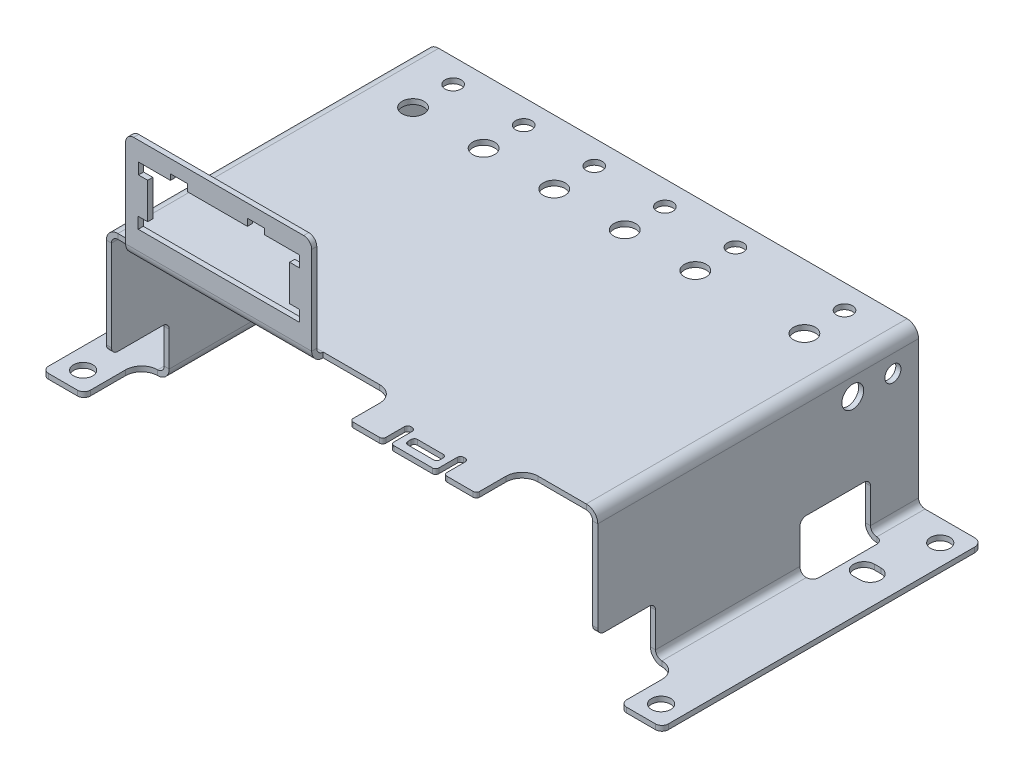
from build123d import *

# Parameters (mm, degrees)
SKETCH1_W                      = 150
SKETCH1_H                      = 100
BASE_FLANGE1_DEPTH             = 1.5875
EDGE_FLANGE1_STRIP_W           = 20.35
EDGE_FLANGE1_STRIP_H           = 1.5875
EDGE_FLANGE1_STRIP_CUT_DEPTH   = 100
EDGE_FLANGE1_STRIP_2_W         = 20.35
EDGE_FLANGE1_STRIP_2_H         = 1.5875
EDGE_FLANGE1_STRIP_CUT_2_DEPTH = 100
EDGE_FLANGE1_DEPTH             = 100
EDGE_FLANGE1_BEND_DEPTH        = 100
EDGE_FLANGE2_STRIP_W           = 20.35
EDGE_FLANGE2_STRIP_H           = 1.5875
EDGE_FLANGE2_STRIP_CUT_DEPTH   = 100
EDGE_FLANGE2_STRIP_2_W         = 20.35
EDGE_FLANGE2_STRIP_2_H         = 1.5875
EDGE_FLANGE2_STRIP_CUT_2_DEPTH = 100
EDGE_FLANGE2_DEPTH             = 100
EDGE_FLANGE2_BEND_DEPTH        = 100
CUT_EXTRUDE1_START             = -50.175
CUT_EXTRUDE1_OUTLINE_W         = 167.175
CUT_EXTRUDE1_OUTLINE_H         = 18
CUT_EXTRUDE1_DEPTH             = 3.5875
FILLET1_R                      = 5
CUT_EXTRUDE2_DEPTH             = 188.101873988
CUT_EXTRUDE2_DEPTH_BACK        = 188.101873988
SKETCH19_W                     = 18
SKETCH19_H                     = 14.75
FILLET2_R                      = 2
CUT_EXTRUDE4_DEPTH             = 120.777609682
CUT_EXTRUDE5_START             = -50.175
CUT_EXTRUDE5_OUTLINE_W         = 3.5875
CUT_EXTRUDE5_OUTLINE_H         = 22
CUT_EXTRUDE5_DEPTH             = 16.3375
FILLET3_R                      = 2
FILLET4_R                      = 2.5
SKETCH22_W                     = 10
SKETCH22_H                     = 3
TAB1_DEPTH                     = 1.5875
FILLET5_R                      = 1
EDGE_FLANGE3_DEPTH             = 58
FILLET6_R                      = 2.5
CUT_EXTRUDE6_DEPTH             = 10
FILLET7_R                      = 5
SKETCH31_R                     = 3
CUT_EXTRUDE10_DEPTH            = 127.39121125
SKETCH33_R                     = 2.5
SKETCH33_R_2                   = 3.4
CUT_EXTRUDE11_DEPTH            = 10
SKETCH35_W                     = 2
SKETCH35_H                     = 22
CUT_EXTRUDE13_DEPTH            = 142.249965708
FILLET8_R                      = 2
CUT_EXTRUDE15_DEPTH            = 127.39121125
CUT_EXTRUDE15_DEPTH_BACK       = 127.39121125
SKETCH43_R                     = 2.5
SKETCH43_R_2                   = 3.4


# Read off the part's stored shape, not the designer's step: Cut-Extrude1, Cut-Extrude5
# Sheet-metal steps are written as plain solids
with BuildPart() as part:
    # Sketch1 → Base-Flange1 (new body)
    with BuildSketch(Plane(origin=(0, 0, 0), x_dir=(1, 0, 0), z_dir=(0, 1, 0))):
        Rectangle(SKETCH1_W, SKETCH1_H)
    extrude(amount=-BASE_FLANGE1_DEPTH)

    # Edge-Flange1 strip (across the edge) → Edge-Flange1 strip cut (cut)
    with BuildSketch(Plane(origin=(-75, -1.5875, 50), x_dir=(1, 0, 0), z_dir=(0, 0, -1))):
        with Locations((-8.175, -0.79375)):
            Rectangle(EDGE_FLANGE1_STRIP_W, EDGE_FLANGE1_STRIP_H)
    extrude(amount=EDGE_FLANGE1_STRIP_CUT_DEPTH, mode=Mode.SUBTRACT)

    # Edge-Flange1 strip 2 (across the edge) → Edge-Flange1 strip cut 2 (cut)
    with BuildSketch(Plane(origin=(75, -1.5875, -50), x_dir=(-1, 0, 0), z_dir=(0, 0, 1))):
        with Locations((-8.175, -0.79375)):
            Rectangle(EDGE_FLANGE1_STRIP_2_W, EDGE_FLANGE1_STRIP_2_H)
    extrude(amount=EDGE_FLANGE1_STRIP_CUT_2_DEPTH, mode=Mode.SUBTRACT)

    # Edge-Flange1 section (across the edge) → Edge-Flange1 (add)
    with BuildSketch(Plane(origin=(-75, -1.5875, 50), x_dir=(1, 0, 0), z_dir=(0, 0, -1))):
        with BuildLine():
            Line((-1.5875, 2), (-1.5875, 47))
            Line((-1.5875, 47), (0, 47))
            Line((0, 47), (0, 2))
            ThreePointArc((0, 2), (0.585786438, 0.585786438), (2, 0))
            Line((2, 0), (2, -1.5875))
            ThreePointArc((2, -1.5875), (-0.536745578, -0.536745578), (-1.5875, 2))
        make_face()
    extrude(amount=EDGE_FLANGE1_DEPTH)

    # Edge-Flange1 section 2 (across the edge) → Edge-Flange1 bend (add)
    with BuildSketch(Plane(origin=(75, -1.5875, -50), x_dir=(-1, 0, 0), z_dir=(0, 0, 1))):
        with BuildLine():
            Line((-1.5875, 2), (-1.5875, 47))
            Line((-1.5875, 47), (0, 47))
            Line((0, 47), (0, 2))
            ThreePointArc((0, 2), (0.585786438, 0.585786438), (2, 0))
            Line((2, 0), (2, -1.5875))
            ThreePointArc((2, -1.5875), (-0.536745578, -0.536745578), (-1.5875, 2))
        make_face()
    extrude(amount=EDGE_FLANGE1_BEND_DEPTH)

    # Edge-Flange2 strip (across the edge) → Edge-Flange2 strip cut (cut)
    with BuildSketch(Plane(origin=(76.5875, -48.5875, 50), x_dir=(0, 1, 0), z_dir=(0, 0, -1))):
        with Locations((-8.175, -0.79375)):
            Rectangle(EDGE_FLANGE2_STRIP_W, EDGE_FLANGE2_STRIP_H)
    extrude(amount=EDGE_FLANGE2_STRIP_CUT_DEPTH, mode=Mode.SUBTRACT)

    # Edge-Flange2 strip 2 (across the edge) → Edge-Flange2 strip cut 2 (cut)
    with BuildSketch(Plane(origin=(-76.5875, -48.5875, -50), x_dir=(0, 1, 0), z_dir=(0, 0, 1))):
        with Locations((-8.175, -0.79375)):
            Rectangle(EDGE_FLANGE2_STRIP_2_W, EDGE_FLANGE2_STRIP_2_H)
    extrude(amount=EDGE_FLANGE2_STRIP_CUT_2_DEPTH, mode=Mode.SUBTRACT)

    # Edge-Flange2 section (across the edge) → Edge-Flange2 (add)
    with BuildSketch(Plane(origin=(76.5875, -48.5875, 50), x_dir=(0, 1, 0), z_dir=(0, 0, -1))):
        with BuildLine():
            Line((-1.5875, 2), (-1.5875, 20))
            Line((-1.5875, 20), (0, 20))
            Line((0, 20), (0, 2))
            ThreePointArc((0, 2), (0.585786438, 0.585786438), (2, 0))
            Line((2, 0), (2, -1.5875))
            ThreePointArc((2, -1.5875), (-0.536745578, -0.536745578), (-1.5875, 2))
        make_face()
    extrude(amount=EDGE_FLANGE2_DEPTH)

    # Edge-Flange2 section 2 (across the edge) → Edge-Flange2 bend (add)
    with BuildSketch(Plane(origin=(-76.5875, -48.5875, -50), x_dir=(0, 1, 0), z_dir=(0, 0, 1))):
        with BuildLine():
            Line((-1.5875, 2), (-1.5875, 20))
            Line((-1.5875, 20), (0, 20))
            Line((0, 20), (0, 2))
            ThreePointArc((0, 2), (0.585786438, 0.585786438), (2, 0))
            Line((2, 0), (2, -1.5875))
            ThreePointArc((2, -1.5875), (-0.536745578, -0.536745578), (-1.5875, 2))
        make_face()
    extrude(amount=EDGE_FLANGE2_BEND_DEPTH)

    # Cut-Extrude1 outline → Cut-Extrude1 (cut)
    with BuildSketch(Plane(origin=(0, 0, 0), x_dir=(1, 0, 0), z_dir=(0, 1, 0)).offset(CUT_EXTRUDE1_START)):
        with Locations((0, -41)):
            Rectangle(CUT_EXTRUDE1_OUTLINE_W, CUT_EXTRUDE1_OUTLINE_H)
    extrude(amount=CUT_EXTRUDE1_DEPTH, mode=Mode.SUBTRACT)

    # Fillet1
    fillet1_edges = [part.edges().sort_by_distance(p)[0] for p in [
        (-83.5875, -49.38125, 32),
        (83.5875, -49.38125, 32),
    ]]
    fillet(fillet1_edges, radius=FILLET1_R)

    # Sketch19 → Cut-Extrude2 (cut, two sides: drawn at the far end of the back side and taken through both)
    with BuildSketch(Plane(origin=(76.5875, 0, 0), x_dir=(0, 0, -1), z_dir=(1, 0, 0)).offset(-CUT_EXTRUDE2_DEPTH_BACK)):
        with Locations((-41, -41.2125)):
            Rectangle(SKETCH19_W, SKETCH19_H)
    extrude(amount=CUT_EXTRUDE2_DEPTH + CUT_EXTRUDE2_DEPTH_BACK, mode=Mode.SUBTRACT)

    # Fillet2
    fillet2_edges = [part.edges().sort_by_distance(p)[0] for p in [
        (96.5875, -49.38125, 50),
        (-96.5875, -49.38125, 50),
        (83.5875, -49.38125, 50),
        (-83.5875, -49.38125, 50),
        (75.79375, -33.8375, 50),
        (75.79375, -33.8375, 32),
        (-75.79375, -33.8375, 32),
        (-75.79375, -33.8375, 50),
    ]]
    fillet(fillet2_edges, radius=FILLET2_R)

    # Sketch20 → Cut-Extrude4 (cut, through all)
    with BuildSketch(Plane(origin=(0, 0, 0), x_dir=(1, 0, 0), z_dir=(0, 1, 0))):
        with BuildLine():
            Line((85.5875, 20.75), (87.5875, 20.75))
            ThreePointArc((87.5875, 20.75), (90.8375, 24), (87.5875, 27.25))
            Line((87.5875, 27.25), (85.5875, 27.25))
            ThreePointArc((85.5875, 27.25), (82.3375, 24), (85.5875, 20.75))
        make_face()
        with BuildLine():
            Line((-85.5875, 20.75), (-87.5875, 20.75))
            ThreePointArc((-87.5875, 20.75), (-90.8375, 24), (-87.5875, 27.25))
            Line((-87.5875, 27.25), (-85.5875, 27.25))
            ThreePointArc((-85.5875, 27.25), (-82.3375, 24), (-85.5875, 20.75))
        make_face()
    extrude(amount=-CUT_EXTRUDE4_DEPTH, mode=Mode.SUBTRACT)

    # Cut-Extrude5 outline → Cut-Extrude5 (cut)
    with BuildSketch(Plane(origin=(0, 0, 0), x_dir=(1, 0, 0), z_dir=(0, 1, 0)).offset(CUT_EXTRUDE5_START)):
        with Locations((-76.79375, 24)):
            Rectangle(CUT_EXTRUDE5_OUTLINE_W, CUT_EXTRUDE5_OUTLINE_H)
        with Locations((76.79375, 24)):
            Rectangle(CUT_EXTRUDE5_OUTLINE_W, CUT_EXTRUDE5_OUTLINE_H)
    extrude(amount=CUT_EXTRUDE5_DEPTH, mode=Mode.SUBTRACT)

    # Fillet3
    fillet3_edges = [part.edges().sort_by_distance(p)[0] for p in [
        (-75.79375, -33.8375, -13),
        (-75.79375, -33.8375, -35),
        (75.79375, -33.8375, -35),
        (75.79375, -33.8375, -13),
    ]]
    fillet(fillet3_edges, radius=FILLET3_R)

    # Fillet4
    fillet4_edges = [part.edges().sort_by_distance(p)[0] for p in [
        (96.5875, -49.38125, -50),
        (-96.5875, -49.38125, -50),
    ]]
    fillet(fillet4_edges, radius=FILLET4_R)

    # Sketch22 → Tab1 (add)
    with BuildSketch(Plane(origin=(0, 0, 0), x_dir=(1, 0, 0), z_dir=(0, 1, 0))):
        Polygon((23.8, -64.25), (23.8, -56.5), (26.3, -56.5), (26.3, -64.25), (40.3, -64.25), (40.3, -56.5), (42.8, -56.5), (42.8, -64.25), (53, -64.25), (53, -50), (13.6, -50), (13.6, -64.25), align=None)
        with Locations((33.3, -60.4)):
            Rectangle(SKETCH22_W, SKETCH22_H, mode=Mode.SUBTRACT)
    extrude(amount=-TAB1_DEPTH)

    # Fillet5
    fillet5_edges = [part.edges().sort_by_distance(p)[0] for p in [
        (13.6, -0.79375, 64.25),
        (53, -0.79375, 64.25),
        (42.8, -0.79375, 64.25),
        (42.8, -0.79375, 56.5),
        (40.3, -0.79375, 56.5),
        (40.3, -0.79375, 64.25),
        (26.3, -0.79375, 64.25),
        (26.3, -0.79375, 56.5),
        (23.8, -0.79375, 56.5),
        (23.8, -0.79375, 64.25),
        (38.3, -0.79375, 58.9),
        (38.3, -0.79375, 61.9),
        (28.3, -0.79375, 61.9),
        (28.3, -0.79375, 58.9),
    ]]
    fillet(fillet5_edges, radius=FILLET5_R)

    # Edge-Flange3 section (across the edge) → Edge-Flange3 (add)
    with BuildSketch(Plane(origin=(-67, 0, 52), x_dir=(0, 0, -1), z_dir=(1, 0, 0))):
        with BuildLine():
            Line((-1.5875, 2), (-1.5875, 32))
            Line((-1.5875, 32), (0, 32))
            Line((0, 32), (0, 2))
            ThreePointArc((0, 2), (0.585786438, 0.585786438), (2, 0))
            Line((2, 0), (2, -1.5875))
            ThreePointArc((2, -1.5875), (-0.536745578, -0.536745578), (-1.5875, 2))
        make_face()
    extrude(amount=EDGE_FLANGE3_DEPTH)

    # Fillet6
    fillet6_edges = [part.edges().sort_by_distance(p)[0] for p in [
        (-67, 32, 52.79375),
        (-9, 32, 52.79375),
    ]]
    fillet(fillet6_edges, radius=FILLET6_R)

    # Sketch28 → Cut-Extrude6 (cut)
    with BuildSketch(Plane(origin=(0, 0, 52), x_dir=(-1, 0, 0), z_dir=(0, 0, -1))):
        Polygon((23.65, 27.9), (29.05, 27.9), (29.05, 25.7), (47.65, 25.7), (47.65, 27.9), (53.05, 27.9), (53.05, 26.1), (62.998267234, 26.1), (62.998267234, 22.6), (60.125, 22.6), (60.125, 11.4), (63.075, 11.4), (63.075, 7.9), (12.875, 7.9), (12.875, 11.4), (15.875, 11.4), (15.875, 22.6), (12.748267234, 22.6), (12.748267234, 26.1), (23.65, 26.1), align=None)
    extrude(amount=-CUT_EXTRUDE6_DEPTH, mode=Mode.SUBTRACT)

    # Fillet7
    fillet7_edges = [part.edges().sort_by_distance(p)[0] for p in [
        (13.6, -0.79375, 50),
        (53, -0.79375, 50),
    ]]
    fillet(fillet7_edges, radius=FILLET7_R)

    # Sketch31 → Cut-Extrude10 (cut, through all)
    with BuildSketch(Plane(origin=(0, 0, 0), x_dir=(1, 0, 0), z_dir=(0, 1, 0))):
        with Locations(Location((90.0875, -43.75, 0), (0, 0, 270))):
            Circle(SKETCH31_R)
        with Locations(Location((90.0875, 43.25, 0), (0, 0, 270))):
            Circle(SKETCH31_R)
        with Locations(Location((-90.0875, -43.75, 0), (0, 0, 270))):
            Circle(SKETCH31_R)
        with Locations(Location((-90.0875, 43.25, 0), (0, 0, 270))):
            Circle(SKETCH31_R)
    extrude(amount=-CUT_EXTRUDE10_DEPTH, mode=Mode.SUBTRACT)

    # Sketch33 → Cut-Extrude11 (cut)
    with BuildSketch(Plane(origin=(0, 0, 0), x_dir=(1, 0, 0), z_dir=(0, 1, 0))):
        with Locations(Location((61, 42.5, 0), (0, 0, 270))):
            Circle(SKETCH33_R)
        with Locations(Location((-61, 42.5, 0), (0, 0, 270))):
            Circle(SKETCH33_R)
        with Locations(Location((-61, 30, 0), (0, 0, 270))):
            Circle(SKETCH33_R_2)
        with Locations(Location((61, 30, 0), (0, 0, 270))):
            Circle(SKETCH33_R_2)
        with Locations(Location((-39, 42.5, 0), (0, 0, 270))):
            Circle(SKETCH33_R)
        with Locations(Location((-39, 30, 0), (0, 0, 270))):
            Circle(SKETCH33_R_2)
        with Locations(Location((-17, 42.5, 0), (0, 0, 270))):
            Circle(SKETCH33_R)
        with Locations(Location((-17, 30, 0), (0, 0, 270))):
            Circle(SKETCH33_R_2)
        with Locations(Location((5, 42.5, 0), (0, 0, 270))):
            Circle(SKETCH33_R)
        with Locations(Location((5, 30, 0), (0, 0, 270))):
            Circle(SKETCH33_R_2)
        with Locations(Location((27, 42.5, 0), (0, 0, 270))):
            Circle(SKETCH33_R)
        with Locations(Location((27, 30, 0), (0, 0, 270))):
            Circle(SKETCH33_R_2)
    extrude(amount=-CUT_EXTRUDE11_DEPTH, mode=Mode.SUBTRACT)

    # Sketch35 → Cut-Extrude13 (cut, through all)
    with BuildSketch(Plane(origin=(0, -48.5875, 0), x_dir=(1, 0, 0), z_dir=(0, 1, 0))):
        with Locations((79.5875, 24)):
            Rectangle(SKETCH35_W, SKETCH35_H)
        with Locations((-79.5875, 24)):
            Rectangle(SKETCH35_W, SKETCH35_H)
    extrude(amount=-CUT_EXTRUDE13_DEPTH, mode=Mode.SUBTRACT)

    # Fillet8
    fillet8_edges = [part.edges().sort_by_distance(p)[0] for p in [
        (80.5875, -49.38125, -13),
        (80.5875, -49.38125, -35),
        (-80.5875, -49.38125, -35),
        (-80.5875, -49.38125, -13),
    ]]
    fillet(fillet8_edges, radius=FILLET8_R)

    # Sketch43 → Cut-Extrude15 (cut, two sides: drawn at the far end of the back side and taken through both)
    with BuildSketch(Plane(origin=(0, 0, 0), x_dir=(0, 0, -1), z_dir=(1, 0, 0)).offset(-CUT_EXTRUDE15_DEPTH_BACK)):
        with Locations(Location((42, -9, 0), (0, 0, 270))):
            Circle(SKETCH43_R)
        with Locations(Location((29.5, -9, 0), (0, 0, 270))):
            Circle(SKETCH43_R_2)
    extrude(amount=CUT_EXTRUDE15_DEPTH + CUT_EXTRUDE15_DEPTH_BACK, mode=Mode.SUBTRACT)


solid = part.part
